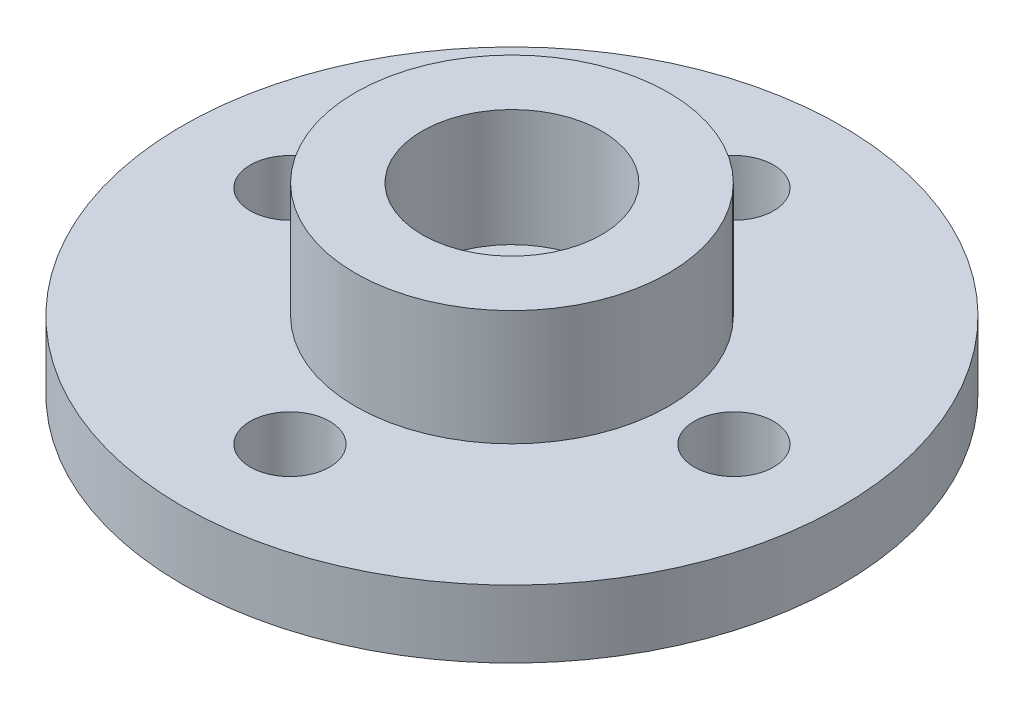
from build123d import *

# Parameters (mm, degrees)
SKETCH1_R           = 10
BOSS_EXTRUDE1_DEPTH = 2.05
SKETCH2_R           = 4.75
BOSS_EXTRUDE2_DEPTH = 3.5
SKETCH3_R           = 2.725
CUT_EXTRUDE1_DEPTH  = 3.55
SKETCH4_R           = 1.375
CUT_EXTRUDE2_DEPTH  = 3.55
SKETCH5_R           = 1.205
CUT_EXTRUDE3_DEPTH  = 3.55
CIRPATTERN1_COUNT   = 4


with BuildPart() as part:
    # Sketch1 → Boss-Extrude1 (new body)
    with BuildSketch(Plane(origin=(0, 0, 0), x_dir=(1, 0, 0), z_dir=(0, 1, 0))):
        Circle(SKETCH1_R)
    extrude(amount=BOSS_EXTRUDE1_DEPTH)

    # Sketch2 → Boss-Extrude2 (add)
    with BuildSketch(Plane(origin=(0, 2.05, 0), x_dir=(1, 0, 0), z_dir=(0, 1, 0))):
        Circle(SKETCH2_R)
    extrude(amount=BOSS_EXTRUDE2_DEPTH)

    # Sketch3 → Cut-Extrude1 (cut)
    with BuildSketch(Plane(origin=(0, 5.55, 0), x_dir=(1, 0, 0), z_dir=(0, 1, 0))):
        Circle(SKETCH3_R)
    extrude(amount=-CUT_EXTRUDE1_DEPTH, mode=Mode.SUBTRACT)

    # Sketch4 → Cut-Extrude2 (cut)
    with BuildSketch(Plane(origin=(0, 2, 0), x_dir=(1, 0, 0), z_dir=(0, 1, 0))):
        Circle(SKETCH4_R)
    extrude(amount=-CUT_EXTRUDE2_DEPTH, mode=Mode.SUBTRACT)

    # Sketch5 → Cut-Extrude3 (cut)
    with BuildSketch(Plane.XZ):
        with Locations((-6.735, 0)):
            Circle(SKETCH5_R)
    cut_extrude3 = extrude(amount=-CUT_EXTRUDE3_DEPTH, mode=Mode.SUBTRACT)

    # CirPattern1: Cut-Extrude3 ×4 about axis
    cirpattern1_axis = Axis((0, -1.55, 0), (0, 1, 0))
    for i in range(1, CIRPATTERN1_COUNT):
        add(cut_extrude3.rotate(cirpattern1_axis, i * 360 / CIRPATTERN1_COUNT), mode=Mode.SUBTRACT)


solid = part.part
